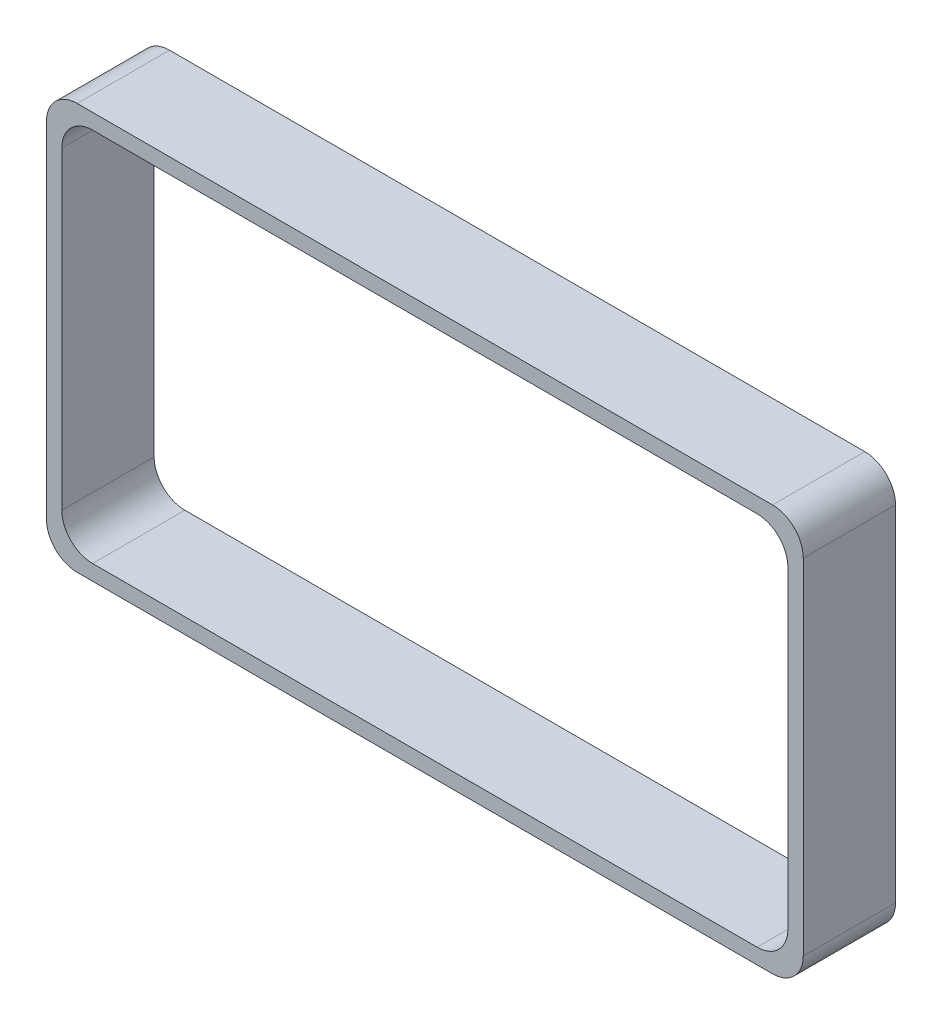
from build123d import *

# Parameters (mm, degrees)
ESQUISSE1_W        = 123
ESQUISSE1_H        = 66
ESQUISSE1_W_2      = 118
ESQUISSE1_H_2      = 61
BOSS_EXTRU_1_DEPTH = 15
CONG_1_R           = 5
CONG_2_R           = 5


with BuildPart() as part:
    # Esquisse1 → Boss.-Extru.1 (new body)
    with BuildSketch(Plane.XY):
        with Locations((59, 30.5)):
            Rectangle(ESQUISSE1_W, ESQUISSE1_H)
        with Locations((59, 30.5)):
            Rectangle(ESQUISSE1_W_2, ESQUISSE1_H_2, mode=Mode.SUBTRACT)
    extrude(amount=BOSS_EXTRU_1_DEPTH)

    # Congé1
    cong_1_edges = [part.edges().sort_by_distance(p)[0] for p in [
        (0, 0, 7.5),
        (118, 0, 7.5),
        (118, 61, 7.5),
        (0, 61, 7.5),
    ]]
    fillet(cong_1_edges, radius=CONG_1_R)

    # Congé2
    cong_2_edges = [part.edges().sort_by_distance(p)[0] for p in [
        (120.5, 63.5, 7.5),
        (120.5, -2.5, 7.5),
        (-2.5, -2.5, 7.5),
        (-2.5, 63.5, 7.5),
    ]]
    fillet(cong_2_edges, radius=CONG_2_R)


solid = part.part
